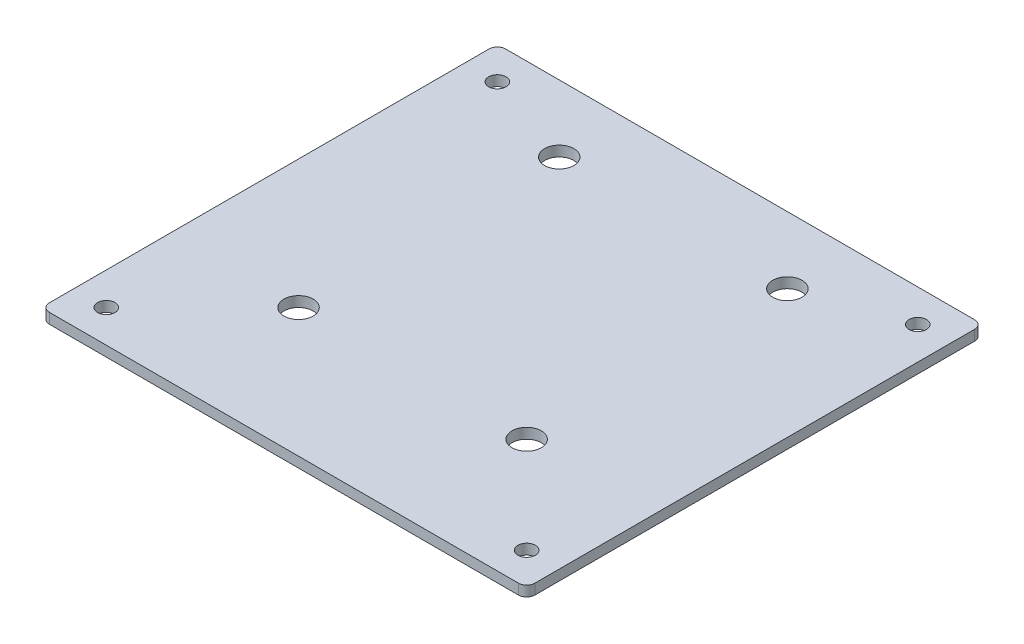
from build123d import *

# Parameters (mm, degrees)
SKETCH1_W           = 149
SKETCH1_H           = 140
BOSS_EXTRUDE1_DEPTH = 3.175
CUT_EXTRUDE1_REACH  = 104.276
SKETCH2_R           = 4.5
CUT_EXTRUDE2_REACH  = 104.276
SKETCH3_R           = 2.665
FILLET1_R           = 2.54


with BuildPart() as part:
    # Sketch1 → Boss-Extrude1 (new body)
    with BuildSketch(Plane(origin=(0, 0, 0), x_dir=(1, 0, 0), z_dir=(0, 1, 0))):
        Rectangle(SKETCH1_W, SKETCH1_H)
    extrude(amount=BOSS_EXTRUDE1_DEPTH)

    # Sketch2 → Cut-Extrude1 (cut, up to next)
    with BuildSketch(Plane(origin=(0, 3.175, 0), x_dir=(1, 0, 0), z_dir=(0, 1, 0)), mode=Mode.PRIVATE) as cut_extrude1_sk1:
        with Locations((-35, 49.5)):
            Circle(SKETCH2_R)
    cut_extrude1_tool1 = extrude(cut_extrude1_sk1.sketch, amount=-CUT_EXTRUDE1_REACH, mode=Mode.PRIVATE) & part.part
    # Sketch2 → Cut-Extrude1 (cut, up to next)
    with BuildSketch(Plane(origin=(0, 3.175, 0), x_dir=(1, 0, 0), z_dir=(0, 1, 0)), mode=Mode.PRIVATE) as cut_extrude1_sk2:
        with Locations((-35, -30.5)):
            Circle(SKETCH2_R)
    cut_extrude1_tool2 = extrude(cut_extrude1_sk2.sketch, amount=-CUT_EXTRUDE1_REACH, mode=Mode.PRIVATE) & part.part
    # Sketch2 → Cut-Extrude1 (cut, up to next)
    with BuildSketch(Plane(origin=(0, 3.175, 0), x_dir=(1, 0, 0), z_dir=(0, 1, 0)), mode=Mode.PRIVATE) as cut_extrude1_sk3:
        with Locations((35, -30.5)):
            Circle(SKETCH2_R)
    cut_extrude1_tool3 = extrude(cut_extrude1_sk3.sketch, amount=-CUT_EXTRUDE1_REACH, mode=Mode.PRIVATE) & part.part
    # Sketch2 → Cut-Extrude1 (cut, up to next)
    with BuildSketch(Plane(origin=(0, 3.175, 0), x_dir=(1, 0, 0), z_dir=(0, 1, 0)), mode=Mode.PRIVATE) as cut_extrude1_sk4:
        with Locations((35, 49.5)):
            Circle(SKETCH2_R)
    cut_extrude1_tool4 = extrude(cut_extrude1_sk4.sketch, amount=-CUT_EXTRUDE1_REACH, mode=Mode.PRIVATE) & part.part
    add(cut_extrude1_tool1.solids().sort_by_distance((-35, 3.175, -49.5))[0], mode=Mode.SUBTRACT)
    add(cut_extrude1_tool2.solids().sort_by_distance((-35, 3.175, 30.5))[0], mode=Mode.SUBTRACT)
    add(cut_extrude1_tool3.solids().sort_by_distance((35, 3.175, 30.5))[0], mode=Mode.SUBTRACT)
    add(cut_extrude1_tool4.solids().sort_by_distance((35, 3.175, -49.5))[0], mode=Mode.SUBTRACT)

    # Sketch3 → Cut-Extrude2 (cut, up to next)
    with BuildSketch(Plane(origin=(0, 3.175, 0), x_dir=(-1, 0, 0), z_dir=(0, 1, 0)), mode=Mode.PRIVATE) as cut_extrude2_sk1:
        with Locations((64.5, 60)):
            Circle(SKETCH3_R)
    cut_extrude2_tool1 = extrude(cut_extrude2_sk1.sketch, amount=-CUT_EXTRUDE2_REACH, mode=Mode.PRIVATE) & part.part
    # Sketch3 → Cut-Extrude2 (cut, up to next)
    with BuildSketch(Plane(origin=(0, 3.175, 0), x_dir=(-1, 0, 0), z_dir=(0, 1, 0)), mode=Mode.PRIVATE) as cut_extrude2_sk2:
        with Locations((-64.5, 60)):
            Circle(SKETCH3_R)
    cut_extrude2_tool2 = extrude(cut_extrude2_sk2.sketch, amount=-CUT_EXTRUDE2_REACH, mode=Mode.PRIVATE) & part.part
    # Sketch3 → Cut-Extrude2 (cut, up to next)
    with BuildSketch(Plane(origin=(0, 3.175, 0), x_dir=(-1, 0, 0), z_dir=(0, 1, 0)), mode=Mode.PRIVATE) as cut_extrude2_sk3:
        with Locations((-64.5, -60)):
            Circle(SKETCH3_R)
    cut_extrude2_tool3 = extrude(cut_extrude2_sk3.sketch, amount=-CUT_EXTRUDE2_REACH, mode=Mode.PRIVATE) & part.part
    # Sketch3 → Cut-Extrude2 (cut, up to next)
    with BuildSketch(Plane(origin=(0, 3.175, 0), x_dir=(-1, 0, 0), z_dir=(0, 1, 0)), mode=Mode.PRIVATE) as cut_extrude2_sk4:
        with Locations((64.5, -60)):
            Circle(SKETCH3_R)
    cut_extrude2_tool4 = extrude(cut_extrude2_sk4.sketch, amount=-CUT_EXTRUDE2_REACH, mode=Mode.PRIVATE) & part.part
    add(cut_extrude2_tool1.solids().sort_by_distance((-64.5, 3.175, 60))[0], mode=Mode.SUBTRACT)
    add(cut_extrude2_tool2.solids().sort_by_distance((64.5, 3.175, 60))[0], mode=Mode.SUBTRACT)
    add(cut_extrude2_tool3.solids().sort_by_distance((64.5, 3.175, -60))[0], mode=Mode.SUBTRACT)
    add(cut_extrude2_tool4.solids().sort_by_distance((-64.5, 3.175, -60))[0], mode=Mode.SUBTRACT)

    # Fillet1
    fillet1_edges = [part.edges().sort_by_distance(p)[0] for p in [
        (-74.5, 1.5875, -70),
        (74.5, 1.5875, -70),
        (74.5, 1.5875, 70),
        (-74.5, 1.5875, 70),
    ]]
    fillet(fillet1_edges, radius=FILLET1_R)


solid = part.part
